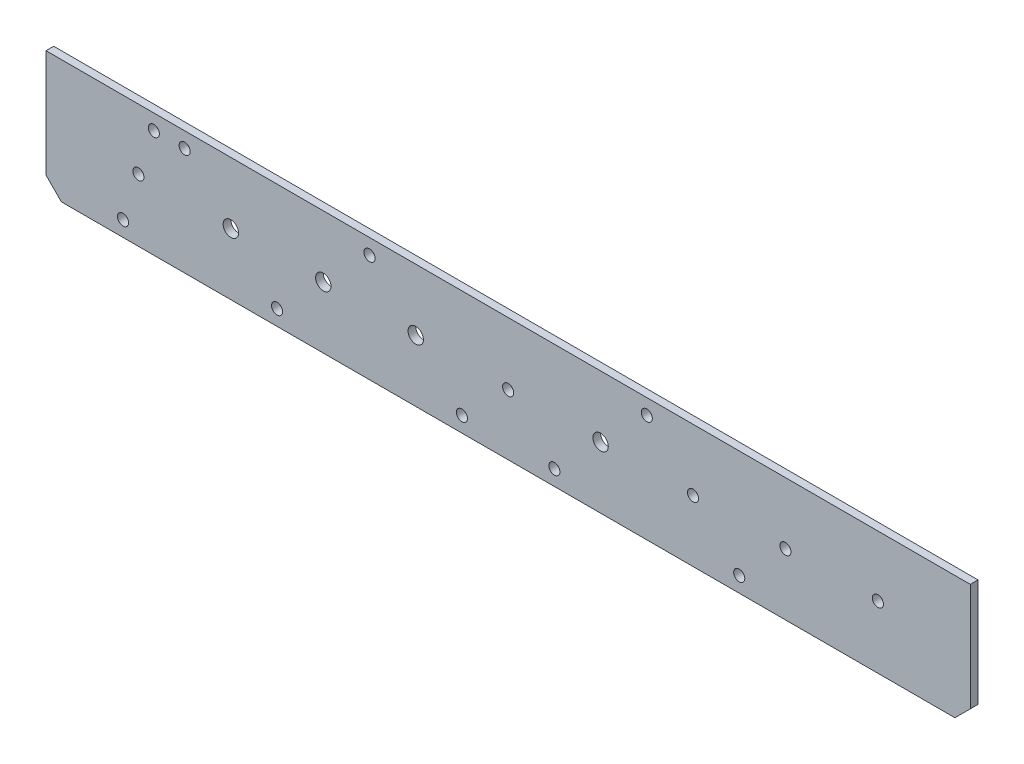
from build123d import *

# Parameters (mm, degrees)
SKETCH1_W           = 381
SKETCH1_H           = 50.8
BOSS_EXTRUDE1_DEPTH = 3.175
CUT_EXTRUDE1_REACH  = 386.385
SKETCH2_R           = 2.286
SKETCH2_R_2         = 3.175


with BuildPart() as part:
    # Sketch1 → Boss-Extrude1 (new body)
    with BuildSketch(Plane.XY):
        with Locations((190.5, 25.4)):
            Rectangle(SKETCH1_W, SKETCH1_H)
    extrude(amount=BOSS_EXTRUDE1_DEPTH)

    # Sketch2 → Cut-Extrude1 (cut, up to next)
    with BuildSketch(Plane.XY.offset(3.175), mode=Mode.PRIVATE) as cut_extrude1_sk1:
        with Locations((38.1, 25.796875)):
            Circle(SKETCH2_R)
    cut_extrude1_tool1 = extrude(cut_extrude1_sk1.sketch, amount=-CUT_EXTRUDE1_REACH, mode=Mode.PRIVATE) & part.part
    # Sketch2 → Cut-Extrude1 (cut, up to next)
    with BuildSketch(Plane.XY.offset(3.175), mode=Mode.PRIVATE) as cut_extrude1_sk2:
        with Locations((190.5, 25.003125)):
            Circle(SKETCH2_R)
    cut_extrude1_tool2 = extrude(cut_extrude1_sk2.sketch, amount=-CUT_EXTRUDE1_REACH, mode=Mode.PRIVATE) & part.part
    # Sketch2 → Cut-Extrude1 (cut, up to next)
    with BuildSketch(Plane.XY.offset(3.175), mode=Mode.PRIVATE) as cut_extrude1_sk3:
        with Locations((114.3, 25.4)):
            Circle(SKETCH2_R_2)
    cut_extrude1_tool3 = extrude(cut_extrude1_sk3.sketch, amount=-CUT_EXTRUDE1_REACH, mode=Mode.PRIVATE) & part.part
    # Sketch2 → Cut-Extrude1 (cut, up to next)
    with BuildSketch(Plane.XY.offset(3.175), mode=Mode.PRIVATE) as cut_extrude1_sk4:
        with Locations((76.2, 25.4)):
            Circle(SKETCH2_R_2)
    cut_extrude1_tool4 = extrude(cut_extrude1_sk4.sketch, amount=-CUT_EXTRUDE1_REACH, mode=Mode.PRIVATE) & part.part
    # Sketch2 → Cut-Extrude1 (cut, up to next)
    with BuildSketch(Plane.XY.offset(3.175), mode=Mode.PRIVATE) as cut_extrude1_sk5:
        with Locations((152.4, 25.4)):
            Circle(SKETCH2_R_2)
    cut_extrude1_tool5 = extrude(cut_extrude1_sk5.sketch, amount=-CUT_EXTRUDE1_REACH, mode=Mode.PRIVATE) & part.part
    # Sketch2 → Cut-Extrude1 (cut, up to next)
    with BuildSketch(Plane.XY.offset(3.175), mode=Mode.PRIVATE) as cut_extrude1_sk6:
        with Locations((228.6, 25.4)):
            Circle(SKETCH2_R_2)
    cut_extrude1_tool6 = extrude(cut_extrude1_sk6.sketch, amount=-CUT_EXTRUDE1_REACH, mode=Mode.PRIVATE) & part.part
    # Sketch2 → Cut-Extrude1 (cut, up to next)
    with BuildSketch(Plane.XY.offset(3.175), mode=Mode.PRIVATE) as cut_extrude1_sk7:
        with Locations((304.8, 25.4)):
            Circle(SKETCH2_R)
    cut_extrude1_tool7 = extrude(cut_extrude1_sk7.sketch, amount=-CUT_EXTRUDE1_REACH, mode=Mode.PRIVATE) & part.part
    # Sketch2 → Cut-Extrude1 (cut, up to next)
    with BuildSketch(Plane.XY.offset(3.175), mode=Mode.PRIVATE) as cut_extrude1_sk8:
        with Locations((266.7, 25.4)):
            Circle(SKETCH2_R)
    cut_extrude1_tool8 = extrude(cut_extrude1_sk8.sketch, amount=-CUT_EXTRUDE1_REACH, mode=Mode.PRIVATE) & part.part
    # Sketch2 → Cut-Extrude1 (cut, up to next)
    with BuildSketch(Plane.XY.offset(3.175), mode=Mode.PRIVATE) as cut_extrude1_sk9:
        with Locations((342.9, 25.796875)):
            Circle(SKETCH2_R)
    cut_extrude1_tool9 = extrude(cut_extrude1_sk9.sketch, amount=-CUT_EXTRUDE1_REACH, mode=Mode.PRIVATE) & part.part
    # Sketch2 → Cut-Extrude1 (cut, up to next)
    with BuildSketch(Plane.XY.offset(3.175), mode=Mode.PRIVATE) as cut_extrude1_sk10:
        with Locations((57.15, 44.45)):
            Circle(SKETCH2_R)
    cut_extrude1_tool10 = extrude(cut_extrude1_sk10.sketch, amount=-CUT_EXTRUDE1_REACH, mode=Mode.PRIVATE) & part.part
    # Sketch2 → Cut-Extrude1 (cut, up to next)
    with BuildSketch(Plane.XY.offset(3.175), mode=Mode.PRIVATE) as cut_extrude1_sk11:
        with Locations((171.45, 6.35)):
            Circle(SKETCH2_R)
    cut_extrude1_tool11 = extrude(cut_extrude1_sk11.sketch, amount=-CUT_EXTRUDE1_REACH, mode=Mode.PRIVATE) & part.part
    # Sketch2 → Cut-Extrude1 (cut, up to next)
    with BuildSketch(Plane.XY.offset(3.175), mode=Mode.PRIVATE) as cut_extrude1_sk12:
        with Locations((209.55, 6.35)):
            Circle(SKETCH2_R)
    cut_extrude1_tool12 = extrude(cut_extrude1_sk12.sketch, amount=-CUT_EXTRUDE1_REACH, mode=Mode.PRIVATE) & part.part
    # Sketch2 → Cut-Extrude1 (cut, up to next)
    with BuildSketch(Plane.XY.offset(3.175), mode=Mode.PRIVATE) as cut_extrude1_sk13:
        with Locations((133.35, 44.45)):
            Circle(SKETCH2_R)
    cut_extrude1_tool13 = extrude(cut_extrude1_sk13.sketch, amount=-CUT_EXTRUDE1_REACH, mode=Mode.PRIVATE) & part.part
    # Sketch2 → Cut-Extrude1 (cut, up to next)
    with BuildSketch(Plane.XY.offset(3.175), mode=Mode.PRIVATE) as cut_extrude1_sk14:
        with Locations((247.65, 44.45)):
            Circle(SKETCH2_R)
    cut_extrude1_tool14 = extrude(cut_extrude1_sk14.sketch, amount=-CUT_EXTRUDE1_REACH, mode=Mode.PRIVATE) & part.part
    # Sketch2 → Cut-Extrude1 (cut, up to next)
    with BuildSketch(Plane.XY.offset(3.175), mode=Mode.PRIVATE) as cut_extrude1_sk15:
        with Locations((95.25, 6.35)):
            Circle(SKETCH2_R)
    cut_extrude1_tool15 = extrude(cut_extrude1_sk15.sketch, amount=-CUT_EXTRUDE1_REACH, mode=Mode.PRIVATE) & part.part
    # Sketch2 → Cut-Extrude1 (cut, up to next)
    with BuildSketch(Plane.XY.offset(3.175), mode=Mode.PRIVATE) as cut_extrude1_sk16:
        with Locations((285.75, 6.35)):
            Circle(SKETCH2_R)
    cut_extrude1_tool16 = extrude(cut_extrude1_sk16.sketch, amount=-CUT_EXTRUDE1_REACH, mode=Mode.PRIVATE) & part.part
    # Sketch2 → Cut-Extrude1 (cut, up to next)
    with BuildSketch(Plane.XY.offset(3.175), mode=Mode.PRIVATE) as cut_extrude1_sk17:
        with Locations((44.45, 44.45)):
            Circle(SKETCH2_R)
    cut_extrude1_tool17 = extrude(cut_extrude1_sk17.sketch, amount=-CUT_EXTRUDE1_REACH, mode=Mode.PRIVATE) & part.part
    # Sketch2 → Cut-Extrude1 (cut, up to next)
    with BuildSketch(Plane.XY.offset(3.175), mode=Mode.PRIVATE) as cut_extrude1_sk18:
        with Locations((31.75, 6.35)):
            Circle(SKETCH2_R)
    cut_extrude1_tool18 = extrude(cut_extrude1_sk18.sketch, amount=-CUT_EXTRUDE1_REACH, mode=Mode.PRIVATE) & part.part
    # Sketch2 → Cut-Extrude1 (cut, up to next)
    with BuildSketch(Plane.XY.offset(3.175), mode=Mode.PRIVATE) as cut_extrude1_sk19:
        Polygon((0, 6.35), (0, 0), (6.35, 0), align=None)
    cut_extrude1_tool19 = extrude(cut_extrude1_sk19.sketch, amount=-CUT_EXTRUDE1_REACH, mode=Mode.PRIVATE) & part.part
    # Sketch2 → Cut-Extrude1 (cut, up to next)
    with BuildSketch(Plane.XY.offset(3.175), mode=Mode.PRIVATE) as cut_extrude1_sk20:
        Polygon((381, 0), (374.65, 0), (381, 6.35), align=None)
    cut_extrude1_tool20 = extrude(cut_extrude1_sk20.sketch, amount=-CUT_EXTRUDE1_REACH, mode=Mode.PRIVATE) & part.part
    add(cut_extrude1_tool1.solids().sort_by_distance((38.1, 25.796875, 3.175))[0], mode=Mode.SUBTRACT)
    add(cut_extrude1_tool2.solids().sort_by_distance((190.5, 25.003125, 3.175))[0], mode=Mode.SUBTRACT)
    add(cut_extrude1_tool3.solids().sort_by_distance((114.3, 25.4, 3.175))[0], mode=Mode.SUBTRACT)
    add(cut_extrude1_tool4.solids().sort_by_distance((76.2, 25.4, 3.175))[0], mode=Mode.SUBTRACT)
    add(cut_extrude1_tool5.solids().sort_by_distance((152.4, 25.4, 3.175))[0], mode=Mode.SUBTRACT)
    add(cut_extrude1_tool6.solids().sort_by_distance((228.6, 25.4, 3.175))[0], mode=Mode.SUBTRACT)
    add(cut_extrude1_tool7.solids().sort_by_distance((304.8, 25.4, 3.175))[0], mode=Mode.SUBTRACT)
    add(cut_extrude1_tool8.solids().sort_by_distance((266.7, 25.4, 3.175))[0], mode=Mode.SUBTRACT)
    add(cut_extrude1_tool9.solids().sort_by_distance((342.9, 25.796875, 3.175))[0], mode=Mode.SUBTRACT)
    add(cut_extrude1_tool10.solids().sort_by_distance((57.15, 44.45, 3.175))[0], mode=Mode.SUBTRACT)
    add(cut_extrude1_tool11.solids().sort_by_distance((171.45, 6.35, 3.175))[0], mode=Mode.SUBTRACT)
    add(cut_extrude1_tool12.solids().sort_by_distance((209.55, 6.35, 3.175))[0], mode=Mode.SUBTRACT)
    add(cut_extrude1_tool13.solids().sort_by_distance((133.35, 44.45, 3.175))[0], mode=Mode.SUBTRACT)
    add(cut_extrude1_tool14.solids().sort_by_distance((247.65, 44.45, 3.175))[0], mode=Mode.SUBTRACT)
    add(cut_extrude1_tool15.solids().sort_by_distance((95.25, 6.35, 3.175))[0], mode=Mode.SUBTRACT)
    add(cut_extrude1_tool16.solids().sort_by_distance((285.75, 6.35, 3.175))[0], mode=Mode.SUBTRACT)
    add(cut_extrude1_tool17.solids().sort_by_distance((44.45, 44.45, 3.175))[0], mode=Mode.SUBTRACT)
    add(cut_extrude1_tool18.solids().sort_by_distance((31.75, 6.35, 3.175))[0], mode=Mode.SUBTRACT)
    add(cut_extrude1_tool19.solids().sort_by_distance((2.116667, 2.116667, 3.175))[0], mode=Mode.SUBTRACT)
    add(cut_extrude1_tool20.solids().sort_by_distance((378.883333, 2.116667, 3.175))[0], mode=Mode.SUBTRACT)


solid = part.part
